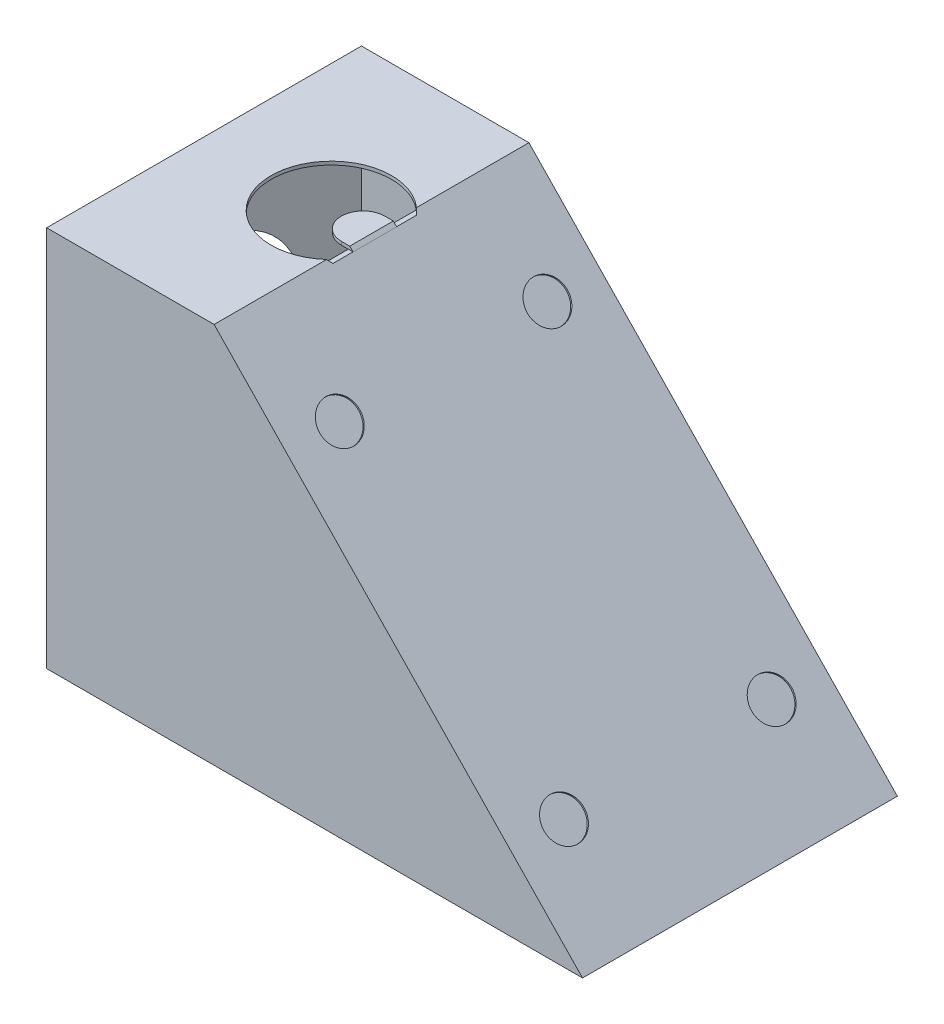
from build123d import *

# Parameters (mm, degrees)
BOSS_EXTRUDE1_DEPTH = 23.876
SHELL1_T            = -0.254
SKETCH2_R           = 7.239
CUT_EXTRUDE1_DEPTH  = 0.254
CHAMFER1_SIZE       = 0.254
SKETCH3_R           = 1.524
CUT_EXTRUDE2_DEPTH  = 0.127
SKETCH9_R           = 4.572
CUT_EXTRUDE3_DEPTH  = 0.254
SKETCH18_W          = 2.286
SKETCH18_H          = 0.254
BOSS_EXTRUDE5_DEPTH = 1.651
CUT_EXTRUDE4_DEPTH  = 3.302
SKETCH20_W          = 3.302
SKETCH20_H          = 0.254
BOSS_EXTRUDE6_DEPTH = 0.254
CUT_EXTRUDE5_DEPTH  = 2.667
BOSS_EXTRUDE7_DEPTH = 0.254


with BuildPart() as part:
    # Sketch1 → Boss-Extrude1 (new body)
    with BuildSketch(Plane.XY):
        Polygon((0, 0), (40.64, 0), (12.7, 28.956), (0, 28.956), align=None)
    extrude(amount=-BOSS_EXTRUDE1_DEPTH)

    # Shell1
    shell1_openings = [part.faces().sort_by_distance(p)[0] for p in [
        (20.32, 0, -11.938),
    ]]
    offset(amount=SHELL1_T, openings=shell1_openings, kind=Kind.INTERSECTION)

    # Sketch2 → Cut-Extrude1 (cut)
    with BuildSketch(Plane.ZY):
        with Locations((-11.938, 14.859)):
            Circle(SKETCH2_R)
    extrude(amount=-CUT_EXTRUDE1_DEPTH, mode=Mode.SUBTRACT)

    # Chamfer1
    chamfer1_edges = [part.edges().sort_by_distance(p)[0] for p in [
        (0, 14.859, -19.177),
    ]]
    chamfer(chamfer1_edges, length=CHAMFER1_SIZE - 0.0001)  # a hair under: the kernel refuses the full size

    # Sketch3 → Cut-Extrude2 (cut)
    with BuildSketch(Plane(origin=(21.045482945, 20.307044947, 0), x_dir=(0, 0, -1), z_dir=(0.7196189619724784, 0.6943691738330935, 0))):
        with Locations(Location((19.812, 4.144798155, 0), (0, 0, 90))):
            Circle(SKETCH3_R)
        with Locations(Location((19.812, -20.345163225, 0), (0, 0, 90))):
            Circle(SKETCH3_R)
        with Locations(Location((4.064, 4.144798155, 0), (0, 0, 90))):
            Circle(SKETCH3_R)
        with Locations(Location((4.064, -20.345163225, 0), (0, 0, 90))):
            Circle(SKETCH3_R)
    extrude(amount=-CUT_EXTRUDE2_DEPTH, mode=Mode.SUBTRACT)

    # Sketch9 → Cut-Extrude3 (cut)
    with BuildSketch(Plane(origin=(0, 28.956, 0), x_dir=(1, 0, 0), z_dir=(0, 1, 0))):
        with Locations((9.652, 11.938)):
            Circle(SKETCH9_R)
    extrude(amount=-CUT_EXTRUDE3_DEPTH, mode=Mode.SUBTRACT)

    # Sketch18 → Boss-Extrude5 (add, symmetric)
    with BuildSketch(Plane.XY.offset(-11.938)):
        with Locations((11.557, 28.829)):
            Rectangle(SKETCH18_W, SKETCH18_H)
    extrude(amount=BOSS_EXTRUDE5_DEPTH, both=True)

    # Sketch19 → Cut-Extrude4 (cut)
    with BuildSketch(Plane(origin=(0, 28.956, 0), x_dir=(1, 0, 0), z_dir=(0, 1, 0))):
        with BuildLine():
            Line((10.414, 10.287), (12.065, 10.287))
            ThreePointArc((12.065, 10.287), (10.897566704, 10.770566704), (10.414, 11.938))
            Line((10.414, 11.938), (10.414, 10.287))
        make_face()
        with BuildLine():
            Line((10.414, 13.589), (10.414, 11.938))
            ThreePointArc((10.414, 11.938), (10.897566704, 13.105433296), (12.065, 13.589))
            Line((12.065, 13.589), (10.414, 13.589))
        make_face()
    extrude(amount=-CUT_EXTRUDE4_DEPTH, mode=Mode.SUBTRACT)

    # Sketch20 → Boss-Extrude6 (add)
    with BuildSketch(Plane(origin=(12.7, 0, 0), x_dir=(0, 0, -1), z_dir=(1, 0, 0))):
        with Locations((11.938, 28.829)):
            Rectangle(SKETCH20_W, SKETCH20_H)
    extrude(amount=BOSS_EXTRUDE6_DEPTH)

    # Sketch22 → Cut-Extrude5 (cut, symmetric)
    with BuildSketch(Plane.XY.offset(-11.938)):
        Polygon((12.7, 28.956), (12.954, 28.702), (12.954, 28.956), align=None)
    extrude(amount=CUT_EXTRUDE5_DEPTH, both=True, mode=Mode.SUBTRACT)

    # Sketch23 → Boss-Extrude7 (add)
    with BuildSketch(Plane.XZ):
        with BuildLine():
            Line((39.652035426, -13.589), (40.287035426, -13.589))
            Line((40.287035426, -13.589), (40.287035426, -10.287))
            Line((40.287035426, -10.287), (39.652035426, -10.287))
            ThreePointArc((39.652035426, -10.287), (38.001035426, -11.938), (39.652035426, -13.589))
        make_face()
    extrude(amount=-BOSS_EXTRUDE7_DEPTH)


solid = part.part
